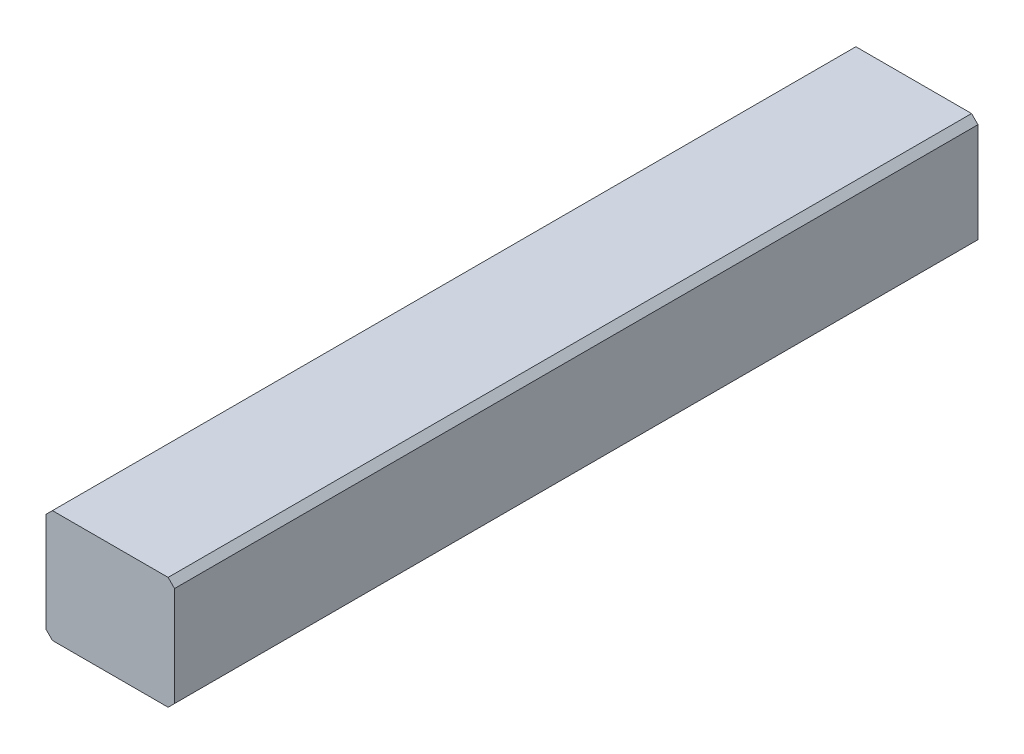
from build123d import *

# Parameters (mm, degrees)
BODY_W         = 8
BODY_H         = 7
EXTRUDE1_DEPTH = 50
CHAMFER1_SIZE  = 0.4


with BuildPart() as part:
    # body → Extrude1 (new body)
    with BuildSketch(Plane.XY):
        with Locations((4, 3.5)):
            Rectangle(BODY_W, BODY_H)
    extrude(amount=EXTRUDE1_DEPTH)

    # Chamfer1
    chamfer1_edges = [part.edges().sort_by_distance(p)[0] for p in [
        (0, 0, 25),
        (8, 0, 25),
        (0, 7, 25),
        (8, 7, 25),
    ]]
    chamfer(chamfer1_edges, length=CHAMFER1_SIZE)


solid = part.part
